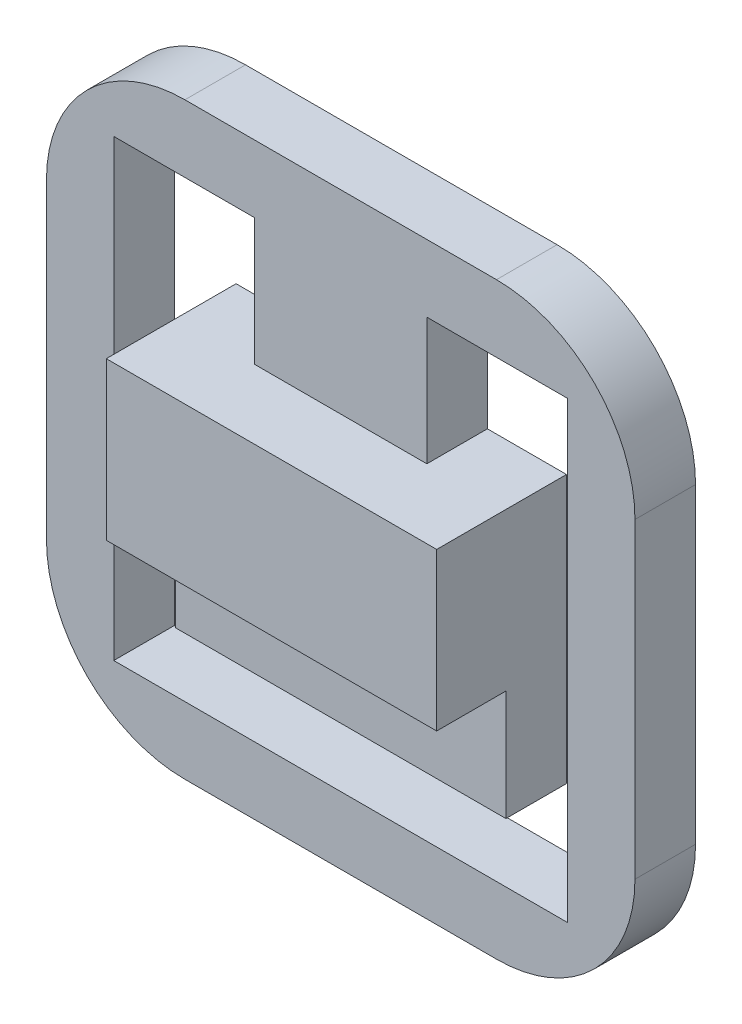
from build123d import *

# Parameters (mm, degrees)
SKETCH2_W           = 34
SKETCH2_H           = 34
BOSS_EXTRUDE1_DEPTH = 3.5
SKETCH4_W           = 19.088264776
SKETCH4_H           = 9.085831195
BOSS_EXTRUDE2_DEPTH = 4
FILLET1_R           = 8


with BuildPart() as part:
    # Sketch2 → Boss-Extrude1 (new body)
    with BuildSketch(Plane.XY):
        Rectangle(SKETCH2_W, SKETCH2_H)
        Polygon((-13.112449761, -13.112449761), (-13.112449761, 13.112449761), (-4.976248984, 13.112449761), (-4.976248984, 5.775025294), (-9.544132388, 5.775025294), (-9.544132388, -9.69135518), (9.544132388, -9.69135518), (9.544132388, 5.775025294), (4.976248984, 5.775025294), (4.976248984, 13.112449761), (13.112449761, 13.112449761), (13.112449761, -13.112449761), align=None, mode=Mode.SUBTRACT)
    extrude(amount=BOSS_EXTRUDE1_DEPTH)

    # Sketch4 → Boss-Extrude2 (add)
    with BuildSketch(Plane.XY.offset(3.5)):
        with Locations((0, 1.232109697)):
            Rectangle(SKETCH4_W, SKETCH4_H)
    extrude(amount=BOSS_EXTRUDE2_DEPTH)

    # Fillet1
    fillet1_edges = [part.edges().sort_by_distance(p)[0] for p in [
        (17, -17, 1.75),
        (-17, -17, 1.75),
        (-17, 17, 1.75),
        (17, 17, 1.75),
    ]]
    fillet(fillet1_edges, radius=FILLET1_R)


solid = part.part
